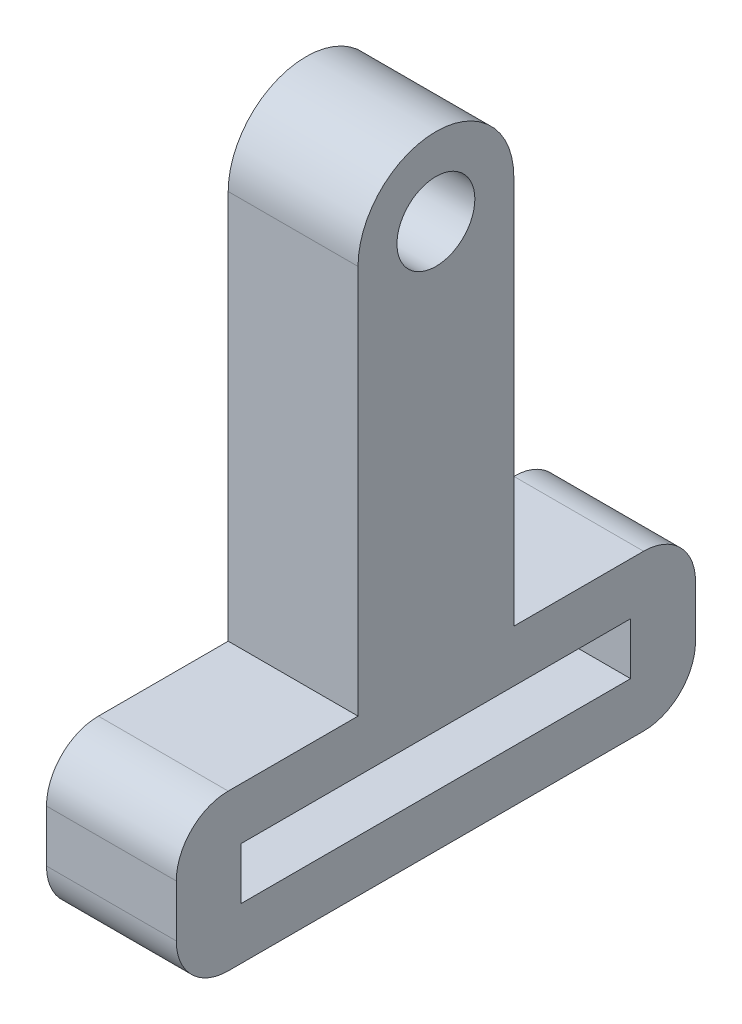
from build123d import *

# Parameters (mm, degrees)
CROQUIS1_R              = 1.5
CROQUIS1_W              = 15
CROQUIS1_H              = 2
SALIENTE_EXTRUIR1_DEPTH = 2.5


with BuildPart() as part:
    # Croquis1 → Saliente-Extruir1 (new, symmetric)
    with BuildSketch(Plane(origin=(0, 0, 0), x_dir=(0, 0, -1), z_dir=(1, 0, 0))):
        with BuildLine():
            Line((-10, 1), (-10, -1))
            ThreePointArc((-10, -1), (-9.414213562, -2.414213562), (-8, -3))
            Line((-8, -3), (8, -3))
            ThreePointArc((8, -3), (9.414213562, -2.414213562), (10, -1))
            Line((10, -1), (10, 1))
            ThreePointArc((10, 1), (9.414213562, 2.414213562), (8, 3))
            Line((8, 3), (3, 3))
            Line((3, 3), (3, 18))
            ThreePointArc((3, 18), (0, 21), (-3, 18))
            Line((-3, 18), (-3, 3))
            Line((-3, 3), (-8, 3))
            ThreePointArc((-8, 3), (-9.414213562, 2.414213562), (-10, 1))
        make_face()
        with Locations((0, 18)):
            Circle(CROQUIS1_R, mode=Mode.SUBTRACT)
        Rectangle(CROQUIS1_W, CROQUIS1_H, mode=Mode.SUBTRACT)
    extrude(amount=SALIENTE_EXTRUIR1_DEPTH, both=True)


solid = part.part
